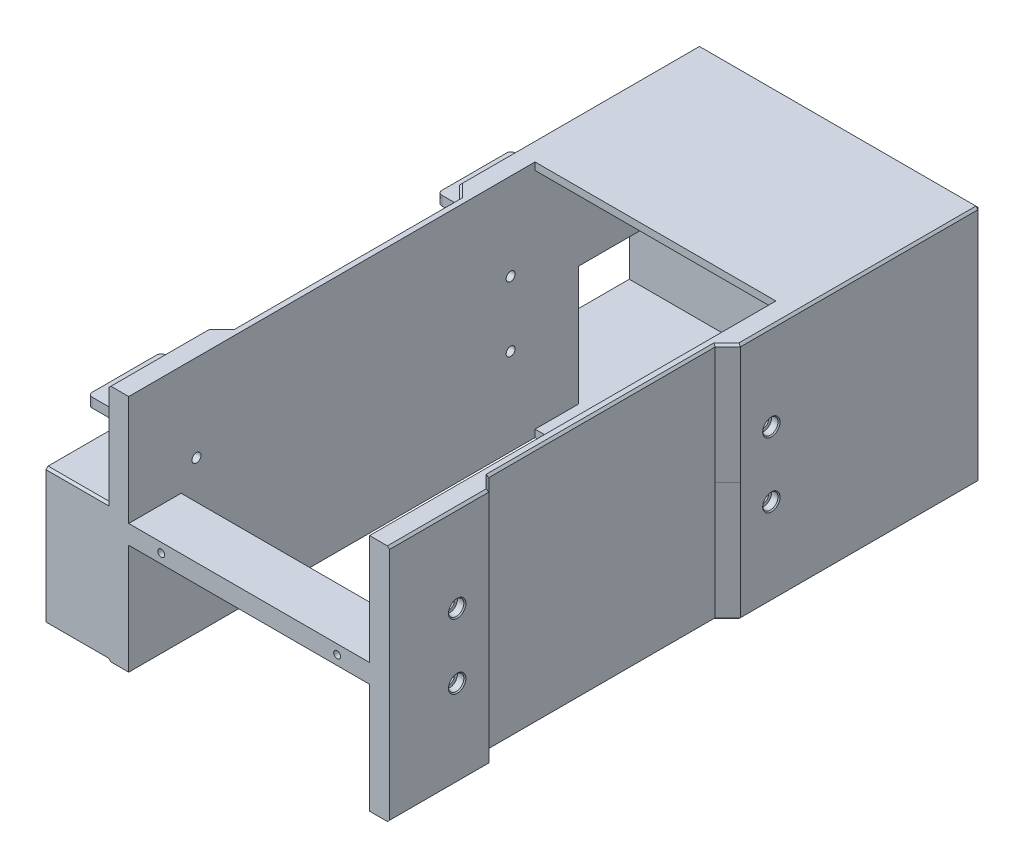
from build123d import *

# Parameters (mm, degrees)
SKETCH1_W                       = 134
SKETCH1_H                       = 57
BOSS_EXTRUDE1_DEPTH             = 282
SKETCH2_W                       = 115
SKETCH2_H                       = 53.5
CUT_EXTRUDE1_DEPTH              = 278.5
SKETCH3_W                       = 115
SKETCH3_H                       = 194
CUT_EXTRUDE2_DEPTH              = 3.5
SKETCH4_W                       = 6
SKETCH4_H                       = 120
CUT_EXTRUDE3_DEPTH              = 318.378323141
CHAMFER1_SIZE                   = 6
SKETCH5_R                       = 2.15
CUT_EXTRUDE4_DEPTH              = 134
SKETCH6_W                       = 25
SKETCH6_H                       = 4.5
BOSS_EXTRUDE2_DEPTH             = 115
SKETCH7_R                       = 3.65
CUT_EXTRUDE5_DEPTH              = 3.6
CUT_EXTRUDE6_START              = -3.6
SKETCH8_R                       = 3.65
CUT_EXTRUDE6_DEPTH              = 3.6
CHAMFER1_OF_MIRROR1_SIZE        = 6
SKETCH9_R                       = 1.65
CUT_EXTRUDE7_DEPTH              = 25
CHAMFER3_SIZE                   = 0.5
SKETCH11_R                      = 1.65
CUT_EXTRUDE9_DEPTH              = 3.5
BOSS_EXTRUDE3_DEPTH             = 50
BOSS_EXTRUDE3_DIRECTION_2_REACH = 319.378
CUT_EXTRUDE10_REACH             = 319.378
SKETCH14_W                      = 20
SKETCH14_H                      = 60.5
SKETCH15_R                      = 2.125
SKETCH15_W                      = 20
SKETCH15_H                      = 40
SKETCH15_H_2                    = 132
CUT_EXTRUDE11_DEPTH             = 4.5
FILLET1_R                       = 2
CHAMFER5_SIZE                   = 1
SKETCH16_W                      = 9.5
SKETCH16_H                      = 1
BOSS_EXTRUDE4_DEPTH             = 1
CHAMFER6_SIZE                   = 1
BOSS_EXTRUDE5_START             = -7
BOSS_EXTRUDE5_OUTLINE_W         = 275
BOSS_EXTRUDE5_OUTLINE_H         = 3.5
BOSS_EXTRUDE5_DEPTH             = 37
CUT_EXTRUDE12_DEPTH             = 9.5


# Read off the part's stored shape, not the designer's step: Boss-Extrude5
# Some blends are built 0.0001 mm under size
with BuildPart() as part:
    # Sketch1 → Boss-Extrude1 (new body)
    with BuildSketch(Plane.XY):
        with Locations((67, 28.5)):
            Rectangle(SKETCH1_W, SKETCH1_H)
    boss_extrude1 = extrude(amount=BOSS_EXTRUDE1_DEPTH)

    # Sketch2 → Cut-Extrude1 (cut)
    with BuildSketch(Plane.XY.offset(282)):
        with Locations((67, 26.75)):
            Rectangle(SKETCH2_W, SKETCH2_H)
    cut_extrude1 = extrude(amount=-CUT_EXTRUDE1_DEPTH, mode=Mode.SUBTRACT)

    # Sketch3 → Cut-Extrude2 (cut)
    with BuildSketch(Plane(origin=(0, 57, 0), x_dir=(1, 0, 0), z_dir=(0, 1, 0))):
        with Locations((67, -185)):
            Rectangle(SKETCH3_W, SKETCH3_H)
    cut_extrude2 = extrude(amount=-CUT_EXTRUDE2_DEPTH, mode=Mode.SUBTRACT)

    # Sketch4 → Cut-Extrude3 (cut, through all)
    with BuildSketch(Plane.XZ):
        with Locations((3, 174.5)):
            Rectangle(SKETCH4_W, SKETCH4_H)
        with Locations((131, 174.5)):
            Rectangle(SKETCH4_W, SKETCH4_H)
    cut_extrude3 = extrude(amount=-CUT_EXTRUDE3_DEPTH, mode=Mode.SUBTRACT)

    # Chamfer1
    chamfer1_edges = [part.edges().sort_by_distance(p)[0] for p in [
        (6, 28.5, 234.5),
        (6, 28.5, 114.5),
        (128, 28.5, 114.5),
        (128, 28.5, 234.5),
    ]]
    chamfer(chamfer1_edges, length=CHAMFER1_SIZE - 0.0001)  # a hair under: the kernel refuses the full size

    # Sketch5 → Cut-Extrude4 (cut)
    with BuildSketch(Plane(origin=(134, 0, 0), x_dir=(0, 0, -1), z_dir=(1, 0, 0))):
        with Locations((-249.65, 15.5)):
            Circle(SKETCH5_R)
        with Locations((-99.65, 15.5)):
            Circle(SKETCH5_R)
    cut_extrude4 = extrude(amount=-CUT_EXTRUDE4_DEPTH, mode=Mode.SUBTRACT)

    # Sketch6 → Boss-Extrude2 (add)
    with BuildSketch(Plane(origin=(9.5, 0, 0), x_dir=(0, 0, -1), z_dir=(1, 0, 0))):
        with Locations((-269.5, 2.25)):
            Rectangle(SKETCH6_W, SKETCH6_H)
    boss_extrude2 = extrude(amount=BOSS_EXTRUDE2_DEPTH)

    # Sketch7 → Cut-Extrude5 (cut)
    with BuildSketch(Plane(origin=(134, 0, 0), x_dir=(0, 0, -1), z_dir=(1, 0, 0))):
        with Locations((-249.65, 15.5)):
            Circle(SKETCH7_R)
        with Locations((-99.65, 15.5)):
            Circle(SKETCH7_R)
    cut_extrude5 = extrude(amount=-CUT_EXTRUDE5_DEPTH, mode=Mode.SUBTRACT)

    # Sketch8 → Cut-Extrude6 (cut)
    with BuildSketch(Plane.ZY.offset(CUT_EXTRUDE6_START)):
        with Locations(Location((249.65, 15.5, 0), (0, 0, 180))):
            Circle(SKETCH8_R)
        with Locations(Location((99.65, 15.5, 0), (0, 0, 180))):
            Circle(SKETCH8_R)
    cut_extrude6 = extrude(amount=CUT_EXTRUDE6_DEPTH, mode=Mode.SUBTRACT)


with BuildPart() as mirror1_1:
    # Mirror1: Boss-Extrude1 across plane
    add(boss_extrude1.mirror(Plane.ZX))

    # Mirror1 2: Cut-Extrude1, Cut-Extrude2, Cut-Extrude3, Cut-Extrude4 across plane
    add(cut_extrude1.mirror(Plane.ZX), mode=Mode.SUBTRACT)
    add(cut_extrude2.mirror(Plane.ZX), mode=Mode.SUBTRACT)
    add(cut_extrude3.mirror(Plane.ZX), mode=Mode.SUBTRACT)
    add(cut_extrude4.mirror(Plane.ZX), mode=Mode.SUBTRACT)

    # Mirror1 4: Cut-Extrude5, Cut-Extrude6 across plane
    add(cut_extrude5.mirror(Plane.ZX), mode=Mode.SUBTRACT)
    add(cut_extrude6.mirror(Plane.ZX), mode=Mode.SUBTRACT)

    # Chamfer1 of Mirror1
    chamfer1_of_mirror1_edges = [mirror1_1.edges().sort_by_distance(p)[0] for p in [
        (6, -28.5, 234.5),
        (6, -28.5, 114.5),
        (128, -28.5, 114.5),
        (128, -28.5, 234.5),
    ]]
    chamfer(chamfer1_of_mirror1_edges, length=CHAMFER1_OF_MIRROR1_SIZE - 0.0001)  # a hair under: the kernel refuses the full size


with BuildPart() as mirror1_3_1:
    # Mirror1 3: Boss-Extrude2 across plane
    add(boss_extrude2.mirror(Plane.ZX))


with BuildPart() as part_1:
    add(part.part)

    # Mirror1 united with what the copies touc: union Mirror1_1, Mirror1 3_1
    add(mirror1_1.part)
    add(mirror1_3_1.part)

    # Sketch9 → Cut-Extrude7 (cut)
    with BuildSketch(Plane.XY.offset(282)):
        with Locations((25, 0)):
            Circle(SKETCH9_R)
        with Locations((109, 0)):
            Circle(SKETCH9_R)
    extrude(amount=-CUT_EXTRUDE7_DEPTH, mode=Mode.SUBTRACT)

    # Chamfer2
    # the kernel refuses this chamfer: 1 mm, written as the material it takes off along each edge
    with BuildSketch(Plane(origin=(133.333333333, -56.333333333, 0.666666667), x_dir=(-0.7071067811865475, -0.7071067811865475, 0), z_dir=(0.5773502691896257, -0.5773502691896258, -0.5773502691896258))) as chamfer2_piece_1:
        Polygon((-0.707106781, -0.40824829), (0.707106781, -0.40824829), (0, 0.816496581), align=None)
    extrude(amount=1.270170592, mode=Mode.SUBTRACT)
    with BuildSketch(Plane(origin=(0.666666667, -56.333333333, 0.666666667), x_dir=(0.7071067811865475, -0.7071067811865475, 0), z_dir=(-0.5773502691896258, -0.5773502691896258, -0.5773502691896258)), Plane(origin=(133.333333333, 56.333333333, 0.666666667), x_dir=(-0.7071067811865475, 0.7071067811865475, 0), z_dir=(0.5773502691896257, 0.5773502691896258, -0.5773502691896258)), Plane(origin=(0.666666667, 56.333333333, 0.666666667), x_dir=(-0.7071067811865475, -0.7071067811865475, 0), z_dir=(-0.5773502691896257, 0.5773502691896258, -0.5773502691896257))) as chamfer2_piece_2:
        Polygon((-0.707106781, 0.40824829), (0.707106781, 0.40824829), (0, -0.816496581), align=None)
    extrude(amount=1.270170592, mode=Mode.SUBTRACT)
    with BuildSketch(Plane(origin=(0, -57, 231.928317012), x_dir=(0.9996219169112968, -0.02749587661058908, 0), z_dir=(0, 0, 1)), Plane(origin=(134, 57, 231.928317012), x_dir=(-0.9996219169112968, 0.027495876610589196, 0), z_dir=(0, 0, 1))) as chamfer2_piece_3:
        with BuildLine():
            Line((1.028673195, 0), (-0.056547155, 1.027117794))
            Line((-0.056547155, 1.027117794), (-0.076539593, 1.026567876))
            ThreePointArc((-0.076539593, 1.026567876), (-0.034129227, 0.51339783), (-0.019992438, -0.000549918))
            Line((-0.019992438, -0.000549918), (0.000549918, -0.019992438))
            ThreePointArc((0.000549918, -0.019992438), (0.514497665, -0.00585565), (1.029223113, -0.019992438))
            Line((1.029223113, -0.019992438), (1.028673195, 0))
        make_face()
    extrude(amount=52.643365976, mode=Mode.SUBTRACT)
    with BuildSketch(Plane(origin=(134, -57, 231.928317012), x_dir=(-0.9996219169112968, -0.027495876610589196, 0), z_dir=(0, 0, 1)), Plane(origin=(0, 57, 231.928317012), x_dir=(0.9996219169112968, 0.02749587661058908, 0), z_dir=(0, 0, 1))) as chamfer2_piece_4:
        with BuildLine():
            Line((1.028673195, 0), (-0.056547155, -1.027117794))
            Line((-0.056547155, -1.027117794), (-0.076539593, -1.026567876))
            ThreePointArc((-0.076539593, -1.026567876), (-0.034129227, -0.51339783), (-0.019992438, 0.000549918))
            Line((-0.019992438, 0.000549918), (0.000549918, 0.019992438))
            ThreePointArc((0.000549918, 0.019992438), (0.514497665, 0.00585565), (1.029223113, 0.019992438))
            Line((1.029223113, 0.019992438), (1.028673195, 0))
        make_face()
    extrude(amount=52.643365976, mode=Mode.SUBTRACT)
    with BuildSketch(Plane(origin=(136.571682988, -57, 0), x_dir=(0, -0.02749587661058908, 0.9996219169112968), z_dir=(-1, 0, 0))) as chamfer2_piece_5:
        with BuildLine():
            Line((1.028673195, 0), (-0.056547155, 1.027117794))
            Line((-0.056547155, 1.027117794), (-0.076539593, 1.026567876))
            ThreePointArc((-0.076539593, 1.026567876), (-0.034129227, 0.51339783), (-0.019992438, -0.000549918))
            Line((-0.019992438, -0.000549918), (0.000549918, -0.019992438))
            ThreePointArc((0.000549918, -0.019992438), (0.514497665, -0.00585565), (1.029223113, -0.019992438))
            Line((1.029223113, -0.019992438), (1.028673195, 0))
        make_face()
    extrude(amount=139.143365976, mode=Mode.SUBTRACT)
    with BuildSketch(Plane(origin=(134, -57, -2.571682988), x_dir=(0.027495876610582105, 0.999621916911297, 0), z_dir=(0, 0, 1)), Plane(origin=(0, -57, -2.571682988), x_dir=(0.9996219169112968, -0.02749587661058908, 0), z_dir=(0, 0, 1))) as chamfer2_piece_6:
        with BuildLine():
            Line((1.028673195, 0), (-0.056547155, 1.027117794))
            Line((-0.056547155, 1.027117794), (-0.076539593, 1.026567876))
            ThreePointArc((-0.076539593, 1.026567876), (-0.034129227, 0.51339783), (-0.019992438, -0.000549918))
            Line((-0.019992438, -0.000549918), (0.000549918, -0.019992438))
            ThreePointArc((0.000549918, -0.019992438), (0.514497665, -0.00585565), (1.029223113, -0.019992438))
            Line((1.029223113, -0.019992438), (1.028673195, 0))
        make_face()
    extrude(amount=119.643365976, mode=Mode.SUBTRACT)
    with BuildSketch(Plane(origin=(6, -57, 117.928217012), x_dir=(0.9996219169112968, -0.027495876610589075, 0), z_dir=(0, 0, 1))) as chamfer2_piece_7_section:
        with BuildLine():
            Line((1.028673195, 0), (-0.056547155, 1.027117794))
            Line((-0.056547155, 1.027117794), (-0.076539593, 1.026567876))
            ThreePointArc((-0.076539593, 1.026567876), (-0.034129227, 0.51339783), (-0.019992438, -0.000549918))
            Line((-0.019992438, -0.000549918), (0.000549918, -0.019992438))
            ThreePointArc((0.000549918, -0.019992438), (0.514497665, -0.00585565), (1.029223113, -0.019992438))
            Line((1.029223113, -0.019992438), (1.028673195, 0))
        make_face()
    chamfer2_piece_7 = extrude(amount=113.143565976, mode=Mode.PRIVATE)
    chamfer2_piece_7 = split(chamfer2_piece_7, bisect_by=Plane(origin=(33.164355215, -56.669573831, 147.664255215), z_dir=(-0.7071067811865475, 0, 0.7071067811865477)), keep=Keep.TOP, mode=Mode.PRIVATE)
    chamfer2_piece_7 = split(chamfer2_piece_7, bisect_by=Plane(origin=(33.164355215, -56.669573831, 201.335744785), z_dir=(-0.7071067811865472, 0, -0.7071067811865478)), keep=Keep.TOP, mode=Mode.PRIVATE)
    add(chamfer2_piece_7, mode=Mode.SUBTRACT)
    with BuildSketch(Plane(origin=(128, -57, 117.928217012), x_dir=(0.027495876610582105, 0.999621916911297, 0), z_dir=(0, 0, 1))) as chamfer2_piece_8_section:
        with BuildLine():
            Line((1.028673195, 0), (-0.056547155, 1.027117794))
            Line((-0.056547155, 1.027117794), (-0.076539593, 1.026567876))
            ThreePointArc((-0.076539593, 1.026567876), (-0.034129227, 0.51339783), (-0.019992438, -0.000549918))
            Line((-0.019992438, -0.000549918), (0.000549918, -0.019992438))
            ThreePointArc((0.000549918, -0.019992438), (0.514497665, -0.00585565), (1.029223113, -0.019992438))
            Line((1.029223113, -0.019992438), (1.028673195, 0))
        make_face()
    chamfer2_piece_8 = extrude(amount=113.143565976, mode=Mode.PRIVATE)
    chamfer2_piece_8 = split(chamfer2_piece_8, bisect_by=Plane(origin=(100.835644785, -56.669573831, 147.664255215), z_dir=(0.7071067811865476, 0, 0.7071067811865476)), keep=Keep.TOP, mode=Mode.PRIVATE)
    chamfer2_piece_8 = split(chamfer2_piece_8, bisect_by=Plane(origin=(100.835644785, -56.669573831, 201.335744785), z_dir=(0.7071067811865476, 0, -0.7071067811865476)), keep=Keep.TOP, mode=Mode.PRIVATE)
    add(chamfer2_piece_8, mode=Mode.SUBTRACT)
    with BuildSketch(Plane(origin=(-1.81835448, -57, 236.31845448), x_dir=(0.706839436070673, -0.027495876610588662, 0.7068394360706737), z_dir=(0.7071067811865479, 0, -0.7071067811865474))) as chamfer2_piece_9_section:
        with BuildLine():
            Line((1.028673195, 0), (-0.056547155, -1.027117794))
            Line((-0.056547155, -1.027117794), (-0.076539593, -1.026567876))
            ThreePointArc((-0.076539593, -1.026567876), (-0.034129227, -0.51339783), (-0.019992438, 0.000549918))
            Line((-0.019992438, 0.000549918), (0.000549918, 0.019992438))
            ThreePointArc((0.000549918, 0.019992438), (0.514497665, 0.00585565), (1.029223113, 0.019992438))
            Line((1.029223113, 0.019992438), (1.028673195, 0))
        make_face()
    chamfer2_piece_9 = extrude(amount=13.628505929, mode=Mode.PRIVATE)
    chamfer2_piece_9 = split(chamfer2_piece_9, bisect_by=Plane(origin=(6, -56.681906875, 235.533564865), z_dir=(-1, 0, 0)), keep=Keep.TOP, mode=Mode.PRIVATE)
    add(chamfer2_piece_9, mode=Mode.SUBTRACT)
    with BuildSketch(Plane(origin=(7.81845448, -57, 122.31835448), x_dir=(0.7068394360706733, -0.027495876610588946, -0.7068394360706736), z_dir=(-0.7071067811865477, 0, -0.7071067811865475))) as chamfer2_piece_10_section:
        with BuildLine():
            Line((1.028673195, 0), (-0.056547155, -1.027117794))
            Line((-0.056547155, -1.027117794), (-0.076539593, -1.026567876))
            ThreePointArc((-0.076539593, -1.026567876), (-0.034129227, -0.51339783), (-0.019992438, 0.000549918))
            Line((-0.019992438, 0.000549918), (0.000549918, 0.019992438))
            ThreePointArc((0.000549918, 0.019992438), (0.514497665, 0.00585565), (1.029223113, 0.019992438))
            Line((1.029223113, 0.019992438), (1.028673195, 0))
        make_face()
    chamfer2_piece_10 = extrude(amount=13.628505929, mode=Mode.PRIVATE)
    chamfer2_piece_10 = split(chamfer2_piece_10, bisect_by=Plane(origin=(6, -56.661529994, 117.278226705), z_dir=(-1, 0, 0)), keep=Keep.TOP, mode=Mode.PRIVATE)
    add(chamfer2_piece_10, mode=Mode.SUBTRACT)
    with BuildSketch(Plane(origin=(135.81835448, -57, 112.68154552), x_dir=(0.01944252080601719, 0.9996219169112965, 0.01944252080601719), z_dir=(-0.7071067811865476, 0, 0.7071067811865476))) as chamfer2_piece_11_section:
        with BuildLine():
            Line((1.028673195, 0), (-0.056547155, 1.027117794))
            Line((-0.056547155, 1.027117794), (-0.076539593, 1.026567876))
            ThreePointArc((-0.076539593, 1.026567876), (-0.034129227, 0.51339783), (-0.019992438, -0.000549918))
            Line((-0.019992438, -0.000549918), (0.000549918, -0.019992438))
            ThreePointArc((0.000549918, -0.019992438), (0.514497665, -0.00585565), (1.029223113, -0.019992438))
            Line((1.029223113, -0.019992438), (1.028673195, 0))
        make_face()
    chamfer2_piece_11 = extrude(amount=13.628505929, mode=Mode.PRIVATE)
    chamfer2_piece_11 = split(chamfer2_piece_11, bisect_by=Plane(origin=(128, -56.681906875, 113.466435135), z_dir=(1, 0, 0)), keep=Keep.TOP, mode=Mode.PRIVATE)
    add(chamfer2_piece_11, mode=Mode.SUBTRACT)
    with BuildSketch(Plane(origin=(126.18154552, -57, 226.68164552), x_dir=(-0.7068394360706735, -0.027495876610588745, 0.7068394360706735), z_dir=(0.7071067811865476, 0, 0.7071067811865476))) as chamfer2_piece_12_section:
        with BuildLine():
            Line((1.028673195, 0), (-0.056547155, -1.027117794))
            Line((-0.056547155, -1.027117794), (-0.076539593, -1.026567876))
            ThreePointArc((-0.076539593, -1.026567876), (-0.034129227, -0.51339783), (-0.019992438, 0.000549918))
            Line((-0.019992438, 0.000549918), (0.000549918, 0.019992438))
            ThreePointArc((0.000549918, 0.019992438), (0.514497665, 0.00585565), (1.029223113, 0.019992438))
            Line((1.029223113, 0.019992438), (1.028673195, 0))
        make_face()
    chamfer2_piece_12 = extrude(amount=13.628505929, mode=Mode.PRIVATE)
    chamfer2_piece_12 = split(chamfer2_piece_12, bisect_by=Plane(origin=(128, -56.661529994, 231.721773295), z_dir=(1, 0, 0)), keep=Keep.TOP, mode=Mode.PRIVATE)
    add(chamfer2_piece_12, mode=Mode.SUBTRACT)
    with BuildSketch(Plane(origin=(134, 57, -2.571682988), x_dir=(0.027495876610582105, -0.999621916911297, 0), z_dir=(0, 0, 1)), Plane(origin=(0, 57, -2.571682988), x_dir=(0.9996219169112968, 0.02749587661058908, 0), z_dir=(0, 0, 1))) as chamfer2_piece_13:
        with BuildLine():
            Line((1.028673195, 0), (-0.056547155, -1.027117794))
            Line((-0.056547155, -1.027117794), (-0.076539593, -1.026567876))
            ThreePointArc((-0.076539593, -1.026567876), (-0.034129227, -0.51339783), (-0.019992438, 0.000549918))
            Line((-0.019992438, 0.000549918), (0.000549918, 0.019992438))
            ThreePointArc((0.000549918, 0.019992438), (0.514497665, 0.00585565), (1.029223113, 0.019992438))
            Line((1.029223113, 0.019992438), (1.028673195, 0))
        make_face()
    extrude(amount=119.643365976, mode=Mode.SUBTRACT)
    with BuildSketch(Plane(origin=(136.571682988, 57, 0), x_dir=(0, 0.02749587661058908, 0.9996219169112968), z_dir=(-1, 0, 0))) as chamfer2_piece_14:
        with BuildLine():
            Line((1.028673195, 0), (-0.056547155, -1.027117794))
            Line((-0.056547155, -1.027117794), (-0.076539593, -1.026567876))
            ThreePointArc((-0.076539593, -1.026567876), (-0.034129227, -0.51339783), (-0.019992438, 0.000549918))
            Line((-0.019992438, 0.000549918), (0.000549918, 0.019992438))
            ThreePointArc((0.000549918, 0.019992438), (0.514497665, 0.00585565), (1.029223113, 0.019992438))
            Line((1.029223113, 0.019992438), (1.028673195, 0))
        make_face()
    extrude(amount=139.143365976, mode=Mode.SUBTRACT)
    with BuildSketch(Plane(origin=(134, -59.571682988, 0), x_dir=(0.027495876610582174, 0, 0.9996219169112968), z_dir=(0, 1, 0)), Plane(origin=(0, -59.571682988, 0), x_dir=(0.9996219169112968, 0, -0.027495876610586372), z_dir=(0, 1, 0))) as chamfer2_piece_15:
        with BuildLine():
            Line((1.028673195, 0), (-0.056547155, -1.027117794))
            Line((-0.056547155, -1.027117794), (-0.076539593, -1.026567876))
            ThreePointArc((-0.076539593, -1.026567876), (-0.034129227, -0.51339783), (-0.019992438, 0.000549918))
            Line((-0.019992438, 0.000549918), (0.000549918, 0.019992438))
            ThreePointArc((0.000549918, 0.019992438), (0.514497665, 0.00585565), (1.029223113, 0.019992438))
            Line((1.029223113, 0.019992438), (1.028673195, 0))
        make_face()
    extrude(amount=119.143365976, mode=Mode.SUBTRACT)
    with BuildSketch(Plane(origin=(6, 57, 231.071782988), x_dir=(0.9996219169112968, 0.027495876610589075, 0), z_dir=(0, 0, -1))) as chamfer2_piece_16_section:
        with BuildLine():
            Line((1.028673195, 0), (-0.056547155, 1.027117794))
            Line((-0.056547155, 1.027117794), (-0.076539593, 1.026567876))
            ThreePointArc((-0.076539593, 1.026567876), (-0.034129227, 0.51339783), (-0.019992438, -0.000549918))
            Line((-0.019992438, -0.000549918), (0.000549918, -0.019992438))
            ThreePointArc((0.000549918, -0.019992438), (0.514497665, -0.00585565), (1.029223113, -0.019992438))
            Line((1.029223113, -0.019992438), (1.028673195, 0))
        make_face()
    chamfer2_piece_16 = extrude(amount=113.143565976, mode=Mode.PRIVATE)
    chamfer2_piece_16 = split(chamfer2_piece_16, bisect_by=Plane(origin=(33.164355215, 56.669573831, 147.664255215), z_dir=(-0.7071067811865475, 0, 0.7071067811865477)), keep=Keep.TOP, mode=Mode.PRIVATE)
    chamfer2_piece_16 = split(chamfer2_piece_16, bisect_by=Plane(origin=(33.164355215, 56.669573831, 201.335744785), z_dir=(-0.7071067811865472, 0, -0.7071067811865478)), keep=Keep.TOP, mode=Mode.PRIVATE)
    add(chamfer2_piece_16, mode=Mode.SUBTRACT)
    with BuildSketch(Plane(origin=(128, 57, 231.071782988), x_dir=(-0.9996219169112968, 0.027495876610589196, 0), z_dir=(0, 0, -1))) as chamfer2_piece_17_section:
        with BuildLine():
            Line((1.028673195, 0), (-0.056547155, -1.027117794))
            Line((-0.056547155, -1.027117794), (-0.076539593, -1.026567876))
            ThreePointArc((-0.076539593, -1.026567876), (-0.034129227, -0.51339783), (-0.019992438, 0.000549918))
            Line((-0.019992438, 0.000549918), (0.000549918, 0.019992438))
            ThreePointArc((0.000549918, 0.019992438), (0.514497665, 0.00585565), (1.029223113, 0.019992438))
            Line((1.029223113, 0.019992438), (1.028673195, 0))
        make_face()
    chamfer2_piece_17 = extrude(amount=113.143565976, mode=Mode.PRIVATE)
    chamfer2_piece_17 = split(chamfer2_piece_17, bisect_by=Plane(origin=(100.835644785, 56.669573831, 147.664255215), z_dir=(0.7071067811865476, 0, 0.7071067811865476)), keep=Keep.TOP, mode=Mode.PRIVATE)
    chamfer2_piece_17 = split(chamfer2_piece_17, bisect_by=Plane(origin=(100.835644785, 56.669573831, 201.335744785), z_dir=(0.7071067811865476, 0, -0.7071067811865476)), keep=Keep.TOP, mode=Mode.PRIVATE)
    add(chamfer2_piece_17, mode=Mode.SUBTRACT)
    with BuildSketch(Plane(origin=(-1.81835448, 57, 236.31845448), x_dir=(0.706839436070673, 0.027495876610588662, 0.7068394360706737), z_dir=(0.7071067811865479, 0, -0.7071067811865474))) as chamfer2_piece_18_section:
        with BuildLine():
            Line((1.028673195, 0), (-0.056547155, 1.027117794))
            Line((-0.056547155, 1.027117794), (-0.076539593, 1.026567876))
            ThreePointArc((-0.076539593, 1.026567876), (-0.034129227, 0.51339783), (-0.019992438, -0.000549918))
            Line((-0.019992438, -0.000549918), (0.000549918, -0.019992438))
            ThreePointArc((0.000549918, -0.019992438), (0.514497665, -0.00585565), (1.029223113, -0.019992438))
            Line((1.029223113, -0.019992438), (1.028673195, 0))
        make_face()
    chamfer2_piece_18 = extrude(amount=13.628505929, mode=Mode.PRIVATE)
    chamfer2_piece_18 = split(chamfer2_piece_18, bisect_by=Plane(origin=(6, 56.681906875, 235.533564865), z_dir=(-1, 0, 0)), keep=Keep.TOP, mode=Mode.PRIVATE)
    add(chamfer2_piece_18, mode=Mode.SUBTRACT)
    with BuildSketch(Plane(origin=(7.81845448, 57, 122.31835448), x_dir=(0.7068394360706733, 0.027495876610588946, -0.7068394360706736), z_dir=(-0.7071067811865477, 0, -0.7071067811865475))) as chamfer2_piece_19_section:
        with BuildLine():
            Line((1.028673195, 0), (-0.056547155, 1.027117794))
            Line((-0.056547155, 1.027117794), (-0.076539593, 1.026567876))
            ThreePointArc((-0.076539593, 1.026567876), (-0.034129227, 0.51339783), (-0.019992438, -0.000549918))
            Line((-0.019992438, -0.000549918), (0.000549918, -0.019992438))
            ThreePointArc((0.000549918, -0.019992438), (0.514497665, -0.00585565), (1.029223113, -0.019992438))
            Line((1.029223113, -0.019992438), (1.028673195, 0))
        make_face()
    chamfer2_piece_19 = extrude(amount=13.628505929, mode=Mode.PRIVATE)
    chamfer2_piece_19 = split(chamfer2_piece_19, bisect_by=Plane(origin=(6, 56.661529994, 117.278226705), z_dir=(-1, 0, 0)), keep=Keep.TOP, mode=Mode.PRIVATE)
    add(chamfer2_piece_19, mode=Mode.SUBTRACT)
    with BuildSketch(Plane(origin=(135.81835448, 57, 112.68154552), x_dir=(0.01944252080601719, -0.9996219169112965, 0.01944252080601719), z_dir=(-0.7071067811865476, 0, 0.7071067811865476))) as chamfer2_piece_20_section:
        with BuildLine():
            Line((1.028673195, 0), (-0.056547155, -1.027117794))
            Line((-0.056547155, -1.027117794), (-0.076539593, -1.026567876))
            ThreePointArc((-0.076539593, -1.026567876), (-0.034129227, -0.51339783), (-0.019992438, 0.000549918))
            Line((-0.019992438, 0.000549918), (0.000549918, 0.019992438))
            ThreePointArc((0.000549918, 0.019992438), (0.514497665, 0.00585565), (1.029223113, 0.019992438))
            Line((1.029223113, 0.019992438), (1.028673195, 0))
        make_face()
    chamfer2_piece_20 = extrude(amount=13.628505929, mode=Mode.PRIVATE)
    chamfer2_piece_20 = split(chamfer2_piece_20, bisect_by=Plane(origin=(128, 56.681906875, 113.466435135), z_dir=(1, 0, 0)), keep=Keep.TOP, mode=Mode.PRIVATE)
    add(chamfer2_piece_20, mode=Mode.SUBTRACT)
    with BuildSketch(Plane(origin=(126.18154552, 57, 226.68164552), x_dir=(-0.7068394360706735, 0.027495876610588745, 0.7068394360706735), z_dir=(0.7071067811865476, 0, 0.7071067811865476))) as chamfer2_piece_21_section:
        with BuildLine():
            Line((1.028673195, 0), (-0.056547155, 1.027117794))
            Line((-0.056547155, 1.027117794), (-0.076539593, 1.026567876))
            ThreePointArc((-0.076539593, 1.026567876), (-0.034129227, 0.51339783), (-0.019992438, -0.000549918))
            Line((-0.019992438, -0.000549918), (0.000549918, -0.019992438))
            ThreePointArc((0.000549918, -0.019992438), (0.514497665, -0.00585565), (1.029223113, -0.019992438))
            Line((1.029223113, -0.019992438), (1.028673195, 0))
        make_face()
    chamfer2_piece_21 = extrude(amount=13.628505929, mode=Mode.PRIVATE)
    chamfer2_piece_21 = split(chamfer2_piece_21, bisect_by=Plane(origin=(128, 56.661529994, 231.721773295), z_dir=(1, 0, 0)), keep=Keep.TOP, mode=Mode.PRIVATE)
    add(chamfer2_piece_21, mode=Mode.SUBTRACT)
    with BuildSketch(Plane(origin=(7.81845448, -57, 122.31835448), x_dir=(0.7068394360706733, -0.027495876610588946, -0.7068394360706736), z_dir=(-0.7071067811865477, 0, -0.7071067811865475))) as chamfer2_piece_22a_section:
        with BuildLine():
            Line((1.028673195, 0), (-0.056547155, -1.027117794))
            Line((-0.056547155, -1.027117794), (-0.076539593, -1.026567876))
            ThreePointArc((-0.076539593, -1.026567876), (-0.034129227, -0.51339783), (-0.019992438, 0.000549918))
            Line((-0.019992438, 0.000549918), (0.000549918, 0.019992438))
            ThreePointArc((0.000549918, 0.019992438), (0.514497665, 0.00585565), (1.029223113, 0.019992438))
            Line((1.029223113, 0.019992438), (1.028673195, 0))
        make_face()
    chamfer2_piece_22a = extrude(amount=13.628505929, mode=Mode.PRIVATE)
    chamfer2_piece_22a = split(chamfer2_piece_22a, bisect_by=Plane(origin=(6, -56.681906875, 121.036114365), z_dir=(1, 0, 0)), keep=Keep.TOP, mode=Mode.PRIVATE)
    with BuildSketch(Plane(origin=(6, -57, 117.928217012), x_dir=(0.9996219169112968, -0.027495876610589075, 0), z_dir=(0, 0, 1))) as chamfer2_piece_22b_section:
        with BuildLine():
            Line((1.028673195, 0), (-0.056547155, 1.027117794))
            Line((-0.056547155, 1.027117794), (-0.076539593, 1.026567876))
            ThreePointArc((-0.076539593, 1.026567876), (-0.034129227, 0.51339783), (-0.019992438, -0.000549918))
            Line((-0.019992438, -0.000549918), (0.000549918, -0.019992438))
            ThreePointArc((0.000549918, -0.019992438), (0.514497665, -0.00585565), (1.029223113, -0.019992438))
            Line((1.029223113, -0.019992438), (1.028673195, 0))
        make_face()
    chamfer2_piece_22b = extrude(amount=113.143565976, mode=Mode.PRIVATE)
    chamfer2_piece_22b = split(chamfer2_piece_22b, bisect_by=Plane(origin=(5.620839187, -56.681906875, 120.120739187), z_dir=(0.7071067811865475, 0, -0.7071067811865477)), keep=Keep.TOP, mode=Mode.PRIVATE)
    chamfer2_piece_22 = chamfer2_piece_22a & chamfer2_piece_22b
    add(chamfer2_piece_22, mode=Mode.SUBTRACT)
    with BuildSketch(Plane(origin=(6, -57, 117.928217012), x_dir=(0.9996219169112968, -0.027495876610589075, 0), z_dir=(0, 0, 1))) as chamfer2_piece_23a_section:
        with BuildLine():
            Line((1.028673195, 0), (-0.056547155, 1.027117794))
            Line((-0.056547155, 1.027117794), (-0.076539593, 1.026567876))
            ThreePointArc((-0.076539593, 1.026567876), (-0.034129227, 0.51339783), (-0.019992438, -0.000549918))
            Line((-0.019992438, -0.000549918), (0.000549918, -0.019992438))
            ThreePointArc((0.000549918, -0.019992438), (0.514497665, -0.00585565), (1.029223113, -0.019992438))
            Line((1.029223113, -0.019992438), (1.028673195, 0))
        make_face()
    chamfer2_piece_23a = extrude(amount=113.143565976, mode=Mode.PRIVATE)
    chamfer2_piece_23a = split(chamfer2_piece_23a, bisect_by=Plane(origin=(5.620839187, -56.681906875, 228.879260813), z_dir=(0.7071067811865472, 0, 0.7071067811865478)), keep=Keep.TOP, mode=Mode.PRIVATE)
    with BuildSketch(Plane(origin=(-1.81835448, -57, 236.31845448), x_dir=(0.706839436070673, -0.027495876610588662, 0.7068394360706737), z_dir=(0.7071067811865479, 0, -0.7071067811865474))) as chamfer2_piece_23b_section:
        with BuildLine():
            Line((1.028673195, 0), (-0.056547155, -1.027117794))
            Line((-0.056547155, -1.027117794), (-0.076539593, -1.026567876))
            ThreePointArc((-0.076539593, -1.026567876), (-0.034129227, -0.51339783), (-0.019992438, 0.000549918))
            Line((-0.019992438, 0.000549918), (0.000549918, 0.019992438))
            ThreePointArc((0.000549918, 0.019992438), (0.514497665, 0.00585565), (1.029223113, 0.019992438))
            Line((1.029223113, 0.019992438), (1.028673195, 0))
        make_face()
    chamfer2_piece_23b = extrude(amount=13.628505929, mode=Mode.PRIVATE)
    chamfer2_piece_23b = split(chamfer2_piece_23b, bisect_by=Plane(origin=(6, -56.681906875, 227.963885635), z_dir=(1, 0, 0)), keep=Keep.TOP, mode=Mode.PRIVATE)
    chamfer2_piece_23 = chamfer2_piece_23a & chamfer2_piece_23b
    add(chamfer2_piece_23, mode=Mode.SUBTRACT)
    with BuildSketch(Plane(origin=(135.81835448, -57, 112.68154552), x_dir=(0.01944252080601719, 0.9996219169112965, 0.01944252080601719), z_dir=(-0.7071067811865476, 0, 0.7071067811865476))) as chamfer2_piece_24a_section:
        with BuildLine():
            Line((1.028673195, 0), (-0.056547155, 1.027117794))
            Line((-0.056547155, 1.027117794), (-0.076539593, 1.026567876))
            ThreePointArc((-0.076539593, 1.026567876), (-0.034129227, 0.51339783), (-0.019992438, -0.000549918))
            Line((-0.019992438, -0.000549918), (0.000549918, -0.019992438))
            ThreePointArc((0.000549918, -0.019992438), (0.514497665, -0.00585565), (1.029223113, -0.019992438))
            Line((1.029223113, -0.019992438), (1.028673195, 0))
        make_face()
    chamfer2_piece_24a = extrude(amount=13.628505929, mode=Mode.PRIVATE)
    chamfer2_piece_24a = split(chamfer2_piece_24a, bisect_by=Plane(origin=(128, -56.681906875, 121.036114365), z_dir=(-1, 0, 0)), keep=Keep.TOP, mode=Mode.PRIVATE)
    with BuildSketch(Plane(origin=(128, -57, 117.928217012), x_dir=(0.027495876610582105, 0.999621916911297, 0), z_dir=(0, 0, 1))) as chamfer2_piece_24b_section:
        with BuildLine():
            Line((1.028673195, 0), (-0.056547155, 1.027117794))
            Line((-0.056547155, 1.027117794), (-0.076539593, 1.026567876))
            ThreePointArc((-0.076539593, 1.026567876), (-0.034129227, 0.51339783), (-0.019992438, -0.000549918))
            Line((-0.019992438, -0.000549918), (0.000549918, -0.019992438))
            ThreePointArc((0.000549918, -0.019992438), (0.514497665, -0.00585565), (1.029223113, -0.019992438))
            Line((1.029223113, -0.019992438), (1.028673195, 0))
        make_face()
    chamfer2_piece_24b = extrude(amount=113.143565976, mode=Mode.PRIVATE)
    chamfer2_piece_24b = split(chamfer2_piece_24b, bisect_by=Plane(origin=(128.379160813, -56.681906875, 120.120739187), z_dir=(-0.7071067811865476, 0, -0.7071067811865476)), keep=Keep.TOP, mode=Mode.PRIVATE)
    chamfer2_piece_24 = chamfer2_piece_24a & chamfer2_piece_24b
    add(chamfer2_piece_24, mode=Mode.SUBTRACT)
    with BuildSketch(Plane(origin=(128, -57, 117.928217012), x_dir=(0.027495876610582105, 0.999621916911297, 0), z_dir=(0, 0, 1))) as chamfer2_piece_25a_section:
        with BuildLine():
            Line((1.028673195, 0), (-0.056547155, 1.027117794))
            Line((-0.056547155, 1.027117794), (-0.076539593, 1.026567876))
            ThreePointArc((-0.076539593, 1.026567876), (-0.034129227, 0.51339783), (-0.019992438, -0.000549918))
            Line((-0.019992438, -0.000549918), (0.000549918, -0.019992438))
            ThreePointArc((0.000549918, -0.019992438), (0.514497665, -0.00585565), (1.029223113, -0.019992438))
            Line((1.029223113, -0.019992438), (1.028673195, 0))
        make_face()
    chamfer2_piece_25a = extrude(amount=113.143565976, mode=Mode.PRIVATE)
    chamfer2_piece_25a = split(chamfer2_piece_25a, bisect_by=Plane(origin=(128.379160813, -56.681906875, 228.879260813), z_dir=(-0.7071067811865476, 0, 0.7071067811865476)), keep=Keep.TOP, mode=Mode.PRIVATE)
    with BuildSketch(Plane(origin=(126.18154552, -57, 226.68164552), x_dir=(-0.7068394360706735, -0.027495876610588745, 0.7068394360706735), z_dir=(0.7071067811865476, 0, 0.7071067811865476))) as chamfer2_piece_25b_section:
        with BuildLine():
            Line((1.028673195, 0), (-0.056547155, -1.027117794))
            Line((-0.056547155, -1.027117794), (-0.076539593, -1.026567876))
            ThreePointArc((-0.076539593, -1.026567876), (-0.034129227, -0.51339783), (-0.019992438, 0.000549918))
            Line((-0.019992438, 0.000549918), (0.000549918, 0.019992438))
            ThreePointArc((0.000549918, 0.019992438), (0.514497665, 0.00585565), (1.029223113, 0.019992438))
            Line((1.029223113, 0.019992438), (1.028673195, 0))
        make_face()
    chamfer2_piece_25b = extrude(amount=13.628505929, mode=Mode.PRIVATE)
    chamfer2_piece_25b = split(chamfer2_piece_25b, bisect_by=Plane(origin=(128, -56.681906875, 227.963885635), z_dir=(-1, 0, 0)), keep=Keep.TOP, mode=Mode.PRIVATE)
    chamfer2_piece_25 = chamfer2_piece_25a & chamfer2_piece_25b
    add(chamfer2_piece_25, mode=Mode.SUBTRACT)
    with BuildSketch(Plane(origin=(6, 57, 231.071782988), x_dir=(0.9996219169112968, 0.027495876610589075, 0), z_dir=(0, 0, -1))) as chamfer2_piece_26a_section:
        with BuildLine():
            Line((1.028673195, 0), (-0.056547155, 1.027117794))
            Line((-0.056547155, 1.027117794), (-0.076539593, 1.026567876))
            ThreePointArc((-0.076539593, 1.026567876), (-0.034129227, 0.51339783), (-0.019992438, -0.000549918))
            Line((-0.019992438, -0.000549918), (0.000549918, -0.019992438))
            ThreePointArc((0.000549918, -0.019992438), (0.514497665, -0.00585565), (1.029223113, -0.019992438))
            Line((1.029223113, -0.019992438), (1.028673195, 0))
        make_face()
    chamfer2_piece_26a = extrude(amount=113.143565976, mode=Mode.PRIVATE)
    chamfer2_piece_26a = split(chamfer2_piece_26a, bisect_by=Plane(origin=(5.620839187, 56.681906875, 228.879260813), z_dir=(0.7071067811865472, 0, 0.7071067811865478)), keep=Keep.TOP, mode=Mode.PRIVATE)
    with BuildSketch(Plane(origin=(-1.81835448, 57, 236.31845448), x_dir=(0.706839436070673, 0.027495876610588662, 0.7068394360706737), z_dir=(0.7071067811865479, 0, -0.7071067811865474))) as chamfer2_piece_26b_section:
        with BuildLine():
            Line((1.028673195, 0), (-0.056547155, 1.027117794))
            Line((-0.056547155, 1.027117794), (-0.076539593, 1.026567876))
            ThreePointArc((-0.076539593, 1.026567876), (-0.034129227, 0.51339783), (-0.019992438, -0.000549918))
            Line((-0.019992438, -0.000549918), (0.000549918, -0.019992438))
            ThreePointArc((0.000549918, -0.019992438), (0.514497665, -0.00585565), (1.029223113, -0.019992438))
            Line((1.029223113, -0.019992438), (1.028673195, 0))
        make_face()
    chamfer2_piece_26b = extrude(amount=13.628505929, mode=Mode.PRIVATE)
    chamfer2_piece_26b = split(chamfer2_piece_26b, bisect_by=Plane(origin=(6, 56.681906875, 227.963885635), z_dir=(1, 0, 0)), keep=Keep.TOP, mode=Mode.PRIVATE)
    chamfer2_piece_26 = chamfer2_piece_26a & chamfer2_piece_26b
    add(chamfer2_piece_26, mode=Mode.SUBTRACT)
    with BuildSketch(Plane(origin=(7.81845448, 57, 122.31835448), x_dir=(0.7068394360706733, 0.027495876610588946, -0.7068394360706736), z_dir=(-0.7071067811865477, 0, -0.7071067811865475))) as chamfer2_piece_27a_section:
        with BuildLine():
            Line((1.028673195, 0), (-0.056547155, 1.027117794))
            Line((-0.056547155, 1.027117794), (-0.076539593, 1.026567876))
            ThreePointArc((-0.076539593, 1.026567876), (-0.034129227, 0.51339783), (-0.019992438, -0.000549918))
            Line((-0.019992438, -0.000549918), (0.000549918, -0.019992438))
            ThreePointArc((0.000549918, -0.019992438), (0.514497665, -0.00585565), (1.029223113, -0.019992438))
            Line((1.029223113, -0.019992438), (1.028673195, 0))
        make_face()
    chamfer2_piece_27a = extrude(amount=13.628505929, mode=Mode.PRIVATE)
    chamfer2_piece_27a = split(chamfer2_piece_27a, bisect_by=Plane(origin=(6, 56.681906875, 121.036114365), z_dir=(1, 0, 0)), keep=Keep.TOP, mode=Mode.PRIVATE)
    with BuildSketch(Plane(origin=(6, 57, 231.071782988), x_dir=(0.9996219169112968, 0.027495876610589075, 0), z_dir=(0, 0, -1))) as chamfer2_piece_27b_section:
        with BuildLine():
            Line((1.028673195, 0), (-0.056547155, 1.027117794))
            Line((-0.056547155, 1.027117794), (-0.076539593, 1.026567876))
            ThreePointArc((-0.076539593, 1.026567876), (-0.034129227, 0.51339783), (-0.019992438, -0.000549918))
            Line((-0.019992438, -0.000549918), (0.000549918, -0.019992438))
            ThreePointArc((0.000549918, -0.019992438), (0.514497665, -0.00585565), (1.029223113, -0.019992438))
            Line((1.029223113, -0.019992438), (1.028673195, 0))
        make_face()
    chamfer2_piece_27b = extrude(amount=113.143565976, mode=Mode.PRIVATE)
    chamfer2_piece_27b = split(chamfer2_piece_27b, bisect_by=Plane(origin=(5.620839187, 56.681906875, 120.120739187), z_dir=(0.7071067811865475, 0, -0.7071067811865477)), keep=Keep.TOP, mode=Mode.PRIVATE)
    chamfer2_piece_27 = chamfer2_piece_27a & chamfer2_piece_27b
    add(chamfer2_piece_27, mode=Mode.SUBTRACT)
    with BuildSketch(Plane(origin=(128, 57, 231.071782988), x_dir=(-0.9996219169112968, 0.027495876610589196, 0), z_dir=(0, 0, -1))) as chamfer2_piece_28a_section:
        with BuildLine():
            Line((1.028673195, 0), (-0.056547155, -1.027117794))
            Line((-0.056547155, -1.027117794), (-0.076539593, -1.026567876))
            ThreePointArc((-0.076539593, -1.026567876), (-0.034129227, -0.51339783), (-0.019992438, 0.000549918))
            Line((-0.019992438, 0.000549918), (0.000549918, 0.019992438))
            ThreePointArc((0.000549918, 0.019992438), (0.514497665, 0.00585565), (1.029223113, 0.019992438))
            Line((1.029223113, 0.019992438), (1.028673195, 0))
        make_face()
    chamfer2_piece_28a = extrude(amount=113.143565976, mode=Mode.PRIVATE)
    chamfer2_piece_28a = split(chamfer2_piece_28a, bisect_by=Plane(origin=(128.379160813, 56.681906875, 228.879260813), z_dir=(-0.7071067811865476, 0, 0.7071067811865476)), keep=Keep.TOP, mode=Mode.PRIVATE)
    with BuildSketch(Plane(origin=(126.18154552, 57, 226.68164552), x_dir=(-0.7068394360706735, 0.027495876610588745, 0.7068394360706735), z_dir=(0.7071067811865476, 0, 0.7071067811865476))) as chamfer2_piece_28b_section:
        with BuildLine():
            Line((1.028673195, 0), (-0.056547155, 1.027117794))
            Line((-0.056547155, 1.027117794), (-0.076539593, 1.026567876))
            ThreePointArc((-0.076539593, 1.026567876), (-0.034129227, 0.51339783), (-0.019992438, -0.000549918))
            Line((-0.019992438, -0.000549918), (0.000549918, -0.019992438))
            ThreePointArc((0.000549918, -0.019992438), (0.514497665, -0.00585565), (1.029223113, -0.019992438))
            Line((1.029223113, -0.019992438), (1.028673195, 0))
        make_face()
    chamfer2_piece_28b = extrude(amount=13.628505929, mode=Mode.PRIVATE)
    chamfer2_piece_28b = split(chamfer2_piece_28b, bisect_by=Plane(origin=(128, 56.681906875, 227.963885635), z_dir=(-1, 0, 0)), keep=Keep.TOP, mode=Mode.PRIVATE)
    chamfer2_piece_28 = chamfer2_piece_28a & chamfer2_piece_28b
    add(chamfer2_piece_28, mode=Mode.SUBTRACT)
    with BuildSketch(Plane(origin=(135.81835448, 57, 112.68154552), x_dir=(0.01944252080601719, -0.9996219169112965, 0.01944252080601719), z_dir=(-0.7071067811865476, 0, 0.7071067811865476))) as chamfer2_piece_29a_section:
        with BuildLine():
            Line((1.028673195, 0), (-0.056547155, -1.027117794))
            Line((-0.056547155, -1.027117794), (-0.076539593, -1.026567876))
            ThreePointArc((-0.076539593, -1.026567876), (-0.034129227, -0.51339783), (-0.019992438, 0.000549918))
            Line((-0.019992438, 0.000549918), (0.000549918, 0.019992438))
            ThreePointArc((0.000549918, 0.019992438), (0.514497665, 0.00585565), (1.029223113, 0.019992438))
            Line((1.029223113, 0.019992438), (1.028673195, 0))
        make_face()
    chamfer2_piece_29a = extrude(amount=13.628505929, mode=Mode.PRIVATE)
    chamfer2_piece_29a = split(chamfer2_piece_29a, bisect_by=Plane(origin=(128, 56.681906875, 121.036114365), z_dir=(-1, 0, 0)), keep=Keep.TOP, mode=Mode.PRIVATE)
    with BuildSketch(Plane(origin=(128, 57, 231.071782988), x_dir=(-0.9996219169112968, 0.027495876610589196, 0), z_dir=(0, 0, -1))) as chamfer2_piece_29b_section:
        with BuildLine():
            Line((1.028673195, 0), (-0.056547155, -1.027117794))
            Line((-0.056547155, -1.027117794), (-0.076539593, -1.026567876))
            ThreePointArc((-0.076539593, -1.026567876), (-0.034129227, -0.51339783), (-0.019992438, 0.000549918))
            Line((-0.019992438, 0.000549918), (0.000549918, 0.019992438))
            ThreePointArc((0.000549918, 0.019992438), (0.514497665, 0.00585565), (1.029223113, 0.019992438))
            Line((1.029223113, 0.019992438), (1.028673195, 0))
        make_face()
    chamfer2_piece_29b = extrude(amount=113.143565976, mode=Mode.PRIVATE)
    chamfer2_piece_29b = split(chamfer2_piece_29b, bisect_by=Plane(origin=(128.379160813, 56.681906875, 120.120739187), z_dir=(-0.7071067811865476, 0, -0.7071067811865476)), keep=Keep.TOP, mode=Mode.PRIVATE)
    chamfer2_piece_29 = chamfer2_piece_29a & chamfer2_piece_29b
    add(chamfer2_piece_29, mode=Mode.SUBTRACT)

    # Chamfer3
    chamfer3_edges = [part_1.edges().sort_by_distance(p)[0] for p in [
        (134, 15.5, 253.3),
        (134, 15.5, 103.3),
        (0, 15.5, 253.3),
        (0, 15.5, 103.3),
        (134, -15.5, 253.3),
        (134, -15.5, 103.3),
        (0, -15.5, 253.3),
        (0, -15.5, 103.3),
    ]]
    chamfer(chamfer3_edges, length=CHAMFER3_SIZE)

    # Sketch11 → Cut-Extrude9 (cut)
    with BuildSketch(Plane(origin=(0, 0, 0), x_dir=(-1, 0, 0), z_dir=(0, 0, -1))):
        with Locations((-91.25, -20)):
            Circle(SKETCH11_R)
        with Locations((-91.25, 20)):
            Circle(SKETCH11_R)
        Polygon((-67, 0), (-67, 14.25), (-109.5, 14.25), (-115.5, 8.25), (-115.5, -8.25), (-109.5, -14.25), (-67, -14.25), align=None)
    extrude(amount=-CUT_EXTRUDE9_DEPTH, mode=Mode.SUBTRACT)

    # Sketch12 → Boss-Extrude3 (add)
    with BuildSketch(Plane.ZY):
        Polygon((0, 8), (282, 8), (282, -57), (278.5, -57), (278.5, 3.5), (3.5, 3.5), (3.5, -57), (0, -57), align=None)
    extrude(amount=BOSS_EXTRUDE3_DEPTH)

    # Boss-Extrude3 direction 2: up to this face of the body (flat: up to its plane)
    boss_extrude3_direction_2_end = Plane(part_1.part.faces().sort_by_distance((9.5, 0, 143.62463176))[0])
    # Sketch12 → Boss-Extrude3 direction 2 (add, up to the picked face)
    with BuildSketch(Plane.ZY, mode=Mode.PRIVATE) as boss_extrude3_direction_2_sk1:
        Polygon((0, 8), (282, 8), (282, -57), (278.5, -57), (278.5, 3.5), (3.5, 3.5), (3.5, -57), (0, -57), align=None)
    boss_extrude3_direction_2_tool1 = split(extrude(boss_extrude3_direction_2_sk1.sketch, amount=-BOSS_EXTRUDE3_DIRECTION_2_REACH, mode=Mode.PRIVATE), bisect_by=boss_extrude3_direction_2_end, keep=Keep.BOTH, mode=Mode.PRIVATE)
    add(boss_extrude3_direction_2_tool1.solids().sort_by(Axis((0, 5.106058, 141), (1, 0, 0)))[0])

    # Cut-Extrude10: up to this face of the body (flat: up to its plane)
    cut_extrude10_end = Plane(part_1.part.faces().sort_by_distance((131.969444545, -54.969444545, 282))[0])
    # Sketch14 → Cut-Extrude10 (cut, up to the picked face)
    with BuildSketch(Plane(origin=(0, 0, 0), x_dir=(-1, 0, 0), z_dir=(0, 0, -1)), mode=Mode.PRIVATE) as cut_extrude10_sk1:
        with Locations((40, -26.75)):
            Rectangle(SKETCH14_W, SKETCH14_H)
    cut_extrude10_tool1 = split(extrude(cut_extrude10_sk1.sketch, amount=-CUT_EXTRUDE10_REACH, mode=Mode.PRIVATE), bisect_by=cut_extrude10_end, keep=Keep.BOTH, mode=Mode.PRIVATE)
    add(cut_extrude10_tool1.solids().sort_by(Axis((-40, -26.75, 0), (0, 0, 1)))[0], mode=Mode.SUBTRACT)

    # Sketch15 → Cut-Extrude11 (cut)
    with BuildSketch(Plane(origin=(0, 8, 0), x_dir=(1, 0, 0), z_dir=(0, 1, 0))):
        with Locations(Location((-40, -57.5, 0), (0, 0, 270))):
            Circle(SKETCH15_R)
        with Locations(Location((-40, -224.5, 0), (0, 0, 270))):
            Circle(SKETCH15_R)
        with Locations((-40, -20)):
            Rectangle(SKETCH15_W, SKETCH15_H)
        with Locations((-40, -141)):
            Rectangle(SKETCH15_W, SKETCH15_H_2)
        with Locations((-40, -262)):
            Rectangle(SKETCH15_W, SKETCH15_H)
    extrude(amount=-CUT_EXTRUDE11_DEPTH, mode=Mode.SUBTRACT)

    # Fillet1
    fillet1_edges = [part_1.edges().sort_by_distance(p)[0] for p in [
        (-15, 3.5, 278.5),
        (-15, 3.5, 3.5),
        (-30, 5.75, 40),
        (-50, 5.75, 40),
        (-30, 5.75, 242),
        (-50, 5.75, 242),
        (-30, 5.75, 207),
        (-30, 5.75, 75),
        (-50, 5.75, 75),
        (-50, 5.75, 207),
    ]]
    fillet(fillet1_edges, radius=FILLET1_R)

    # Chamfer5
    chamfer5_edges = [part_1.edges().sort_by_distance(p)[0] for p in [
        (-10.25, -57, 282),
        (-14.5, 8, 0),
        (-15, 8, 282),
        (-10.25, -57, 0),
    ]]
    chamfer(chamfer5_edges, length=CHAMFER5_SIZE)

    # Sketch16 → Boss-Extrude4 (add)
    with BuildSketch(Plane.XY.offset(282)):
        with Locations((4.75, -56.5)):
            Rectangle(SKETCH16_W, SKETCH16_H)
    extrude(amount=-BOSS_EXTRUDE4_DEPTH)

    # Chamfer6
    chamfer6_edges = [part_1.edges().sort_by_distance(p)[0] for p in [
        (0, -57, 281.5),
    ]]
    chamfer(chamfer6_edges, length=CHAMFER6_SIZE - 0.0001)  # a hair under: the kernel refuses the full size

    # Boss-Extrude5 outline → Boss-Extrude5 (add)
    with BuildSketch(Plane.ZY.offset(BOSS_EXTRUDE5_START)):
        with Locations((141, -55.25)):
            Rectangle(BOSS_EXTRUDE5_OUTLINE_W, BOSS_EXTRUDE5_OUTLINE_H)
    extrude(amount=BOSS_EXTRUDE5_DEPTH)

    # Sketch18 → Cut-Extrude12 (cut)
    with BuildSketch(Plane.ZY):
        with BuildLine():
            Line((3.5, -53.5), (67.15, -53.5))
            Line((67.15, -53.5), (67.15, 3.5))
            Line((67.15, 3.5), (5.5, 3.5))
            ThreePointArc((5.5, 3.5), (4.085786438, 2.914213562), (3.5, 1.5))
            Line((3.5, 1.5), (3.5, -53.5))
        make_face()
    extrude(amount=-CUT_EXTRUDE12_DEPTH, mode=Mode.SUBTRACT)


solid = part_1.part
